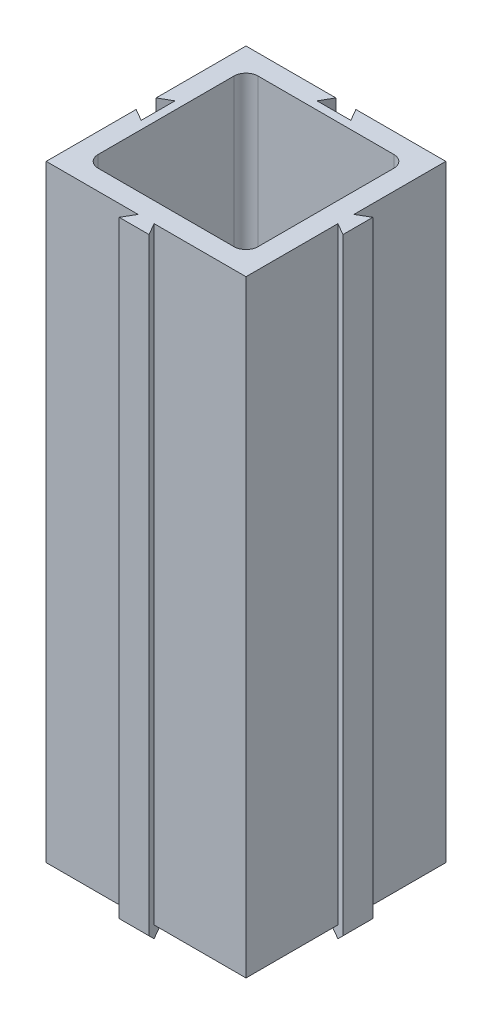
from build123d import *

# Parameters (mm, degrees)
SKETCH1_W               = 20
SKETCH1_H               = 20
BOSS_EXTRUDE1_DEPTH     = 77.5
SKETCH2_W               = 20
SKETCH2_H               = 20
BOSS_EXTRUDE2_DEPTH     = 2.5
CUT_EXTRUDE1_DEPTH      = 78.569323834
CUT_EXTRUDE1_DEPTH_BACK = 78.569323834
SKETCH3_R               = 1.5
CHAMFER1_SIZE           = 1.5
CHAMFER2_SIZE           = 1
FILLET1_R               = 1.5


with BuildPart() as part:
    # Sketch1 → Boss-Extrude1 (new body)
    with BuildSketch(Plane(origin=(0, 0, 0), x_dir=(1, 0, 0), z_dir=(0, 1, 0))):
        Polygon((-11, 2.116025404), (-11, -2.116025404), (-12.5, -1.25), (-12.5, -12.5), (-1, -12.5), (-1.866025404, -14), (1.866025404, -14), (1, -12.5), (12.5, -12.5), (12.5, -1), (14, -1.866025404), (14, 1.866025404), (12.5, 1), (12.5, 12.5), (1.25, 12.5), (2.116025404, 11), (-2.116025404, 11), (-1.25, 12.5), (-12.5, 12.5), (-12.5, 1.25), align=None)
        Rectangle(SKETCH1_W, SKETCH1_H, mode=Mode.SUBTRACT)
    extrude(amount=BOSS_EXTRUDE1_DEPTH)

    # Sketch2 → Boss-Extrude2 (add)
    with BuildSketch(Plane(origin=(0, 0, 0), x_dir=(1, 0, 0), z_dir=(0, 1, 0))):
        Rectangle(SKETCH2_W, SKETCH2_H)
    extrude(amount=BOSS_EXTRUDE2_DEPTH)

    # Sketch3 → Cut-Extrude1 (cut, two sides: drawn at the far end of the back side and taken through both)
    with BuildSketch(Plane(origin=(0, 2.5, 0), x_dir=(1, 0, 0), z_dir=(0, 1, 0)).offset(-CUT_EXTRUDE1_DEPTH_BACK)):
        with Locations(Location((-6, 6, 0), (0, 0, 270))):
            Circle(SKETCH3_R)
        with Locations(Location((6, 6, 0), (0, 0, 90))):
            Circle(SKETCH3_R)
        with Locations(Location((6, -6, 0), (0, 0, 270))):
            Circle(SKETCH3_R)
        with Locations(Location((-6, -6, 0), (0, 0, 90))):
            Circle(SKETCH3_R)
    extrude(amount=CUT_EXTRUDE1_DEPTH + CUT_EXTRUDE1_DEPTH_BACK, mode=Mode.SUBTRACT)

    # Chamfer1
    chamfer1_edges = [part.edges().sort_by_distance(p)[0] for p in [
        (14, 0, 0),
        (12.5, 0, -6.75),
        (6.875, 0, -12.5),
        (0, 0, -11),
        (0, 0, 14),
        (12.5, 0, 6.75),
        (6.75, 0, 12.5),
        (-11, 0, 0),
        (-6.75, 0, 12.5),
        (-12.5, 0, 6.875),
        (-6.875, 0, -12.5),
        (-12.5, 0, -6.875),
    ]]
    chamfer(chamfer1_edges, length=CHAMFER1_SIZE - 0.0001)  # a hair under: the kernel refuses the full size

    # Chamfer2
    chamfer2_edges = [part.edges().sort_by_distance(p)[0] for p in [
        (0, 2.5, -10),
        (-10, 2.5, 0),
        (0, 2.5, 10),
        (10, 2.5, 0),
        (-6, 2.5, 7.5),
        (6, 2.5, 4.5),
        (6, 2.5, -4.5),
        (-6, 2.5, -7.5),
    ]]
    chamfer(chamfer2_edges, length=CHAMFER2_SIZE)

    # Fillet1
    fillet1_edges = [part.edges().sort_by_distance(p)[0] for p in [
        (10, 40.5, -10),
        (-10, 40.5, -10),
        (-10, 40.5, 10),
        (10, 40.5, 10),
    ]]
    fillet(fillet1_edges, radius=FILLET1_R)


solid = part.part
